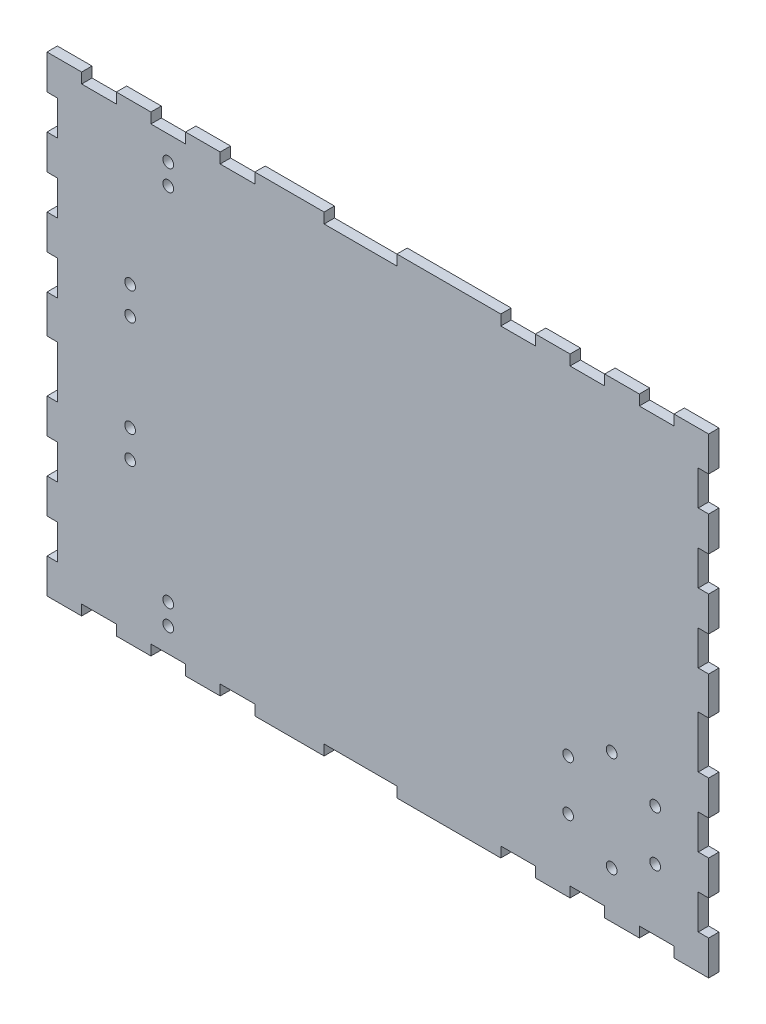
from build123d import *

# Parameters (mm, degrees)
SKETCH2_W           = 191
SKETCH2_H           = 136
SKETCH2_R           = 1.55
SKETCH2_R_2         = 1.549999948
BOSS_EXTRUDE1_DEPTH = 3
CUT_EXTRUDE1_REACH  = 236.491
SKETCH3_W           = 10
SKETCH3_H           = 3
SKETCH3_W_2         = 21
CUT_EXTRUDE2_REACH  = 236.491
SKETCH4_W           = 3
SKETCH4_H           = 10
SKETCH4_H_2         = 15


with BuildPart() as part:
    # Sketch2 → Boss-Extrude1 (new body)
    with BuildSketch(Plane.XY):
        with Locations((95.5, 68)):
            Rectangle(SKETCH2_W, SKETCH2_H)
        with Locations((35, 16)):
            Circle(SKETCH2_R, mode=Mode.SUBTRACT)
        with Locations((35, 10)):
            Circle(SKETCH2_R, mode=Mode.SUBTRACT)
        with Locations((24, 46.069195574)):
            Circle(SKETCH2_R, mode=Mode.SUBTRACT)
        with Locations((24, 54.069195574)):
            Circle(SKETCH2_R, mode=Mode.SUBTRACT)
        with Locations((24, 81.930804426)):
            Circle(SKETCH2_R, mode=Mode.SUBTRACT)
        with Locations((24, 89.930804426)):
            Circle(SKETCH2_R, mode=Mode.SUBTRACT)
        with Locations((35, 120)):
            Circle(SKETCH2_R, mode=Mode.SUBTRACT)
        with Locations((35, 126)):
            Circle(SKETCH2_R, mode=Mode.SUBTRACT)
        with Locations((175.557368355, 35.25)):
            Circle(SKETCH2_R_2, mode=Mode.SUBTRACT)
        with Locations((163, 42.5)):
            Circle(SKETCH2_R_2, mode=Mode.SUBTRACT)
        with Locations((150.442631645, 35.25)):
            Circle(SKETCH2_R_2, mode=Mode.SUBTRACT)
        with Locations((150.442631645, 20.75)):
            Circle(SKETCH2_R_2, mode=Mode.SUBTRACT)
        with Locations((163, 13.5)):
            Circle(SKETCH2_R_2, mode=Mode.SUBTRACT)
        with Locations((175.557368355, 20.75)):
            Circle(SKETCH2_R_2, mode=Mode.SUBTRACT)
    extrude(amount=BOSS_EXTRUDE1_DEPTH)

    # Sketch3 → Cut-Extrude1 (cut, up to next)
    with BuildSketch(Plane.XY.offset(3), mode=Mode.PRIVATE) as cut_extrude1_sk1:
        with Locations((176, 1.5)):
            Rectangle(SKETCH3_W, SKETCH3_H)
    cut_extrude1_tool1 = extrude(cut_extrude1_sk1.sketch, amount=-CUT_EXTRUDE1_REACH, mode=Mode.PRIVATE) & part.part
    # Sketch3 → Cut-Extrude1 (cut, up to next)
    with BuildSketch(Plane.XY.offset(3), mode=Mode.PRIVATE) as cut_extrude1_sk2:
        with Locations((156, 1.5)):
            Rectangle(SKETCH3_W, SKETCH3_H)
    cut_extrude1_tool2 = extrude(cut_extrude1_sk2.sketch, amount=-CUT_EXTRUDE1_REACH, mode=Mode.PRIVATE) & part.part
    # Sketch3 → Cut-Extrude1 (cut, up to next)
    with BuildSketch(Plane.XY.offset(3), mode=Mode.PRIVATE) as cut_extrude1_sk3:
        with Locations((136, 1.5)):
            Rectangle(SKETCH3_W, SKETCH3_H)
    cut_extrude1_tool3 = extrude(cut_extrude1_sk3.sketch, amount=-CUT_EXTRUDE1_REACH, mode=Mode.PRIVATE) & part.part
    # Sketch3 → Cut-Extrude1 (cut, up to next)
    with BuildSketch(Plane.XY.offset(3), mode=Mode.PRIVATE) as cut_extrude1_sk4:
        with Locations((90.5, 1.5)):
            Rectangle(SKETCH3_W_2, SKETCH3_H)
    cut_extrude1_tool4 = extrude(cut_extrude1_sk4.sketch, amount=-CUT_EXTRUDE1_REACH, mode=Mode.PRIVATE) & part.part
    # Sketch3 → Cut-Extrude1 (cut, up to next)
    with BuildSketch(Plane.XY.offset(3), mode=Mode.PRIVATE) as cut_extrude1_sk5:
        with Locations((55, 1.5)):
            Rectangle(SKETCH3_W, SKETCH3_H)
    cut_extrude1_tool5 = extrude(cut_extrude1_sk5.sketch, amount=-CUT_EXTRUDE1_REACH, mode=Mode.PRIVATE) & part.part
    # Sketch3 → Cut-Extrude1 (cut, up to next)
    with BuildSketch(Plane.XY.offset(3), mode=Mode.PRIVATE) as cut_extrude1_sk6:
        with Locations((35, 1.5)):
            Rectangle(SKETCH3_W, SKETCH3_H)
    cut_extrude1_tool6 = extrude(cut_extrude1_sk6.sketch, amount=-CUT_EXTRUDE1_REACH, mode=Mode.PRIVATE) & part.part
    # Sketch3 → Cut-Extrude1 (cut, up to next)
    with BuildSketch(Plane.XY.offset(3), mode=Mode.PRIVATE) as cut_extrude1_sk7:
        with Locations((15, 1.5)):
            Rectangle(SKETCH3_W, SKETCH3_H)
    cut_extrude1_tool7 = extrude(cut_extrude1_sk7.sketch, amount=-CUT_EXTRUDE1_REACH, mode=Mode.PRIVATE) & part.part
    cut_extrude1_1 = cut_extrude1_tool1.solids().sort_by_distance((176, 1.5, 3))[0]
    add(cut_extrude1_1, mode=Mode.SUBTRACT)
    cut_extrude1_2 = cut_extrude1_tool2.solids().sort_by_distance((156, 1.5, 3))[0]
    add(cut_extrude1_2, mode=Mode.SUBTRACT)
    cut_extrude1_3 = cut_extrude1_tool3.solids().sort_by_distance((136, 1.5, 3))[0]
    add(cut_extrude1_3, mode=Mode.SUBTRACT)
    cut_extrude1_4 = cut_extrude1_tool4.solids().sort_by_distance((90.5, 1.5, 3))[0]
    add(cut_extrude1_4, mode=Mode.SUBTRACT)
    cut_extrude1_5 = cut_extrude1_tool5.solids().sort_by_distance((55, 1.5, 3))[0]
    add(cut_extrude1_5, mode=Mode.SUBTRACT)
    cut_extrude1_6 = cut_extrude1_tool6.solids().sort_by_distance((35, 1.5, 3))[0]
    add(cut_extrude1_6, mode=Mode.SUBTRACT)
    cut_extrude1_7 = cut_extrude1_tool7.solids().sort_by_distance((15, 1.5, 3))[0]
    add(cut_extrude1_7, mode=Mode.SUBTRACT)
    cut_extrude1 = cut_extrude1_1 + cut_extrude1_2 + cut_extrude1_3 + cut_extrude1_4 + cut_extrude1_5 + cut_extrude1_6 + cut_extrude1_7  # Cut-Extrude1 as one shape, for the pattern or mirror that repeats it

    # Mirror1: Cut-Extrude1 across plane
    add(cut_extrude1.mirror(Plane.ZX.offset(68)), mode=Mode.SUBTRACT)

    # Sketch4 → Cut-Extrude2 (cut, up to next)
    with BuildSketch(Plane.XY.offset(3), mode=Mode.PRIVATE) as cut_extrude2_sk1:
        with Locations((1.5, 121)):
            Rectangle(SKETCH4_W, SKETCH4_H)
    cut_extrude2_tool1 = extrude(cut_extrude2_sk1.sketch, amount=-CUT_EXTRUDE2_REACH, mode=Mode.PRIVATE) & part.part
    # Sketch4 → Cut-Extrude2 (cut, up to next)
    with BuildSketch(Plane.XY.offset(3), mode=Mode.PRIVATE) as cut_extrude2_sk2:
        with Locations((1.5, 101)):
            Rectangle(SKETCH4_W, SKETCH4_H)
    cut_extrude2_tool2 = extrude(cut_extrude2_sk2.sketch, amount=-CUT_EXTRUDE2_REACH, mode=Mode.PRIVATE) & part.part
    # Sketch4 → Cut-Extrude2 (cut, up to next)
    with BuildSketch(Plane.XY.offset(3), mode=Mode.PRIVATE) as cut_extrude2_sk3:
        with Locations((1.5, 81)):
            Rectangle(SKETCH4_W, SKETCH4_H)
    cut_extrude2_tool3 = extrude(cut_extrude2_sk3.sketch, amount=-CUT_EXTRUDE2_REACH, mode=Mode.PRIVATE) & part.part
    # Sketch4 → Cut-Extrude2 (cut, up to next)
    with BuildSketch(Plane.XY.offset(3), mode=Mode.PRIVATE) as cut_extrude2_sk4:
        with Locations((1.5, 15)):
            Rectangle(SKETCH4_W, SKETCH4_H)
    cut_extrude2_tool4 = extrude(cut_extrude2_sk4.sketch, amount=-CUT_EXTRUDE2_REACH, mode=Mode.PRIVATE) & part.part
    # Sketch4 → Cut-Extrude2 (cut, up to next)
    with BuildSketch(Plane.XY.offset(3), mode=Mode.PRIVATE) as cut_extrude2_sk5:
        with Locations((1.5, 35)):
            Rectangle(SKETCH4_W, SKETCH4_H)
    cut_extrude2_tool5 = extrude(cut_extrude2_sk5.sketch, amount=-CUT_EXTRUDE2_REACH, mode=Mode.PRIVATE) & part.part
    # Sketch4 → Cut-Extrude2 (cut, up to next)
    with BuildSketch(Plane.XY.offset(3), mode=Mode.PRIVATE) as cut_extrude2_sk6:
        with Locations((1.5, 57.5)):
            Rectangle(SKETCH4_W, SKETCH4_H_2)
    cut_extrude2_tool6 = extrude(cut_extrude2_sk6.sketch, amount=-CUT_EXTRUDE2_REACH, mode=Mode.PRIVATE) & part.part
    cut_extrude2_1 = cut_extrude2_tool1.solids().sort_by_distance((1.5, 121, 3))[0]
    add(cut_extrude2_1, mode=Mode.SUBTRACT)
    cut_extrude2_2 = cut_extrude2_tool2.solids().sort_by_distance((1.5, 101, 3))[0]
    add(cut_extrude2_2, mode=Mode.SUBTRACT)
    cut_extrude2_3 = cut_extrude2_tool3.solids().sort_by_distance((1.5, 81, 3))[0]
    add(cut_extrude2_3, mode=Mode.SUBTRACT)
    cut_extrude2_4 = cut_extrude2_tool4.solids().sort_by_distance((1.5, 15, 3))[0]
    add(cut_extrude2_4, mode=Mode.SUBTRACT)
    cut_extrude2_5 = cut_extrude2_tool5.solids().sort_by_distance((1.5, 35, 3))[0]
    add(cut_extrude2_5, mode=Mode.SUBTRACT)
    cut_extrude2_6 = cut_extrude2_tool6.solids().sort_by_distance((1.5, 57.5, 3))[0]
    add(cut_extrude2_6, mode=Mode.SUBTRACT)
    cut_extrude2 = cut_extrude2_1 + cut_extrude2_2 + cut_extrude2_3 + cut_extrude2_4 + cut_extrude2_5 + cut_extrude2_6  # Cut-Extrude2 as one shape, for the pattern or mirror that repeats it

    # Mirror2: Cut-Extrude2 across plane
    add(cut_extrude2.mirror(Plane(origin=(95.5, 0, 0), x_dir=(0, 0, 1), z_dir=(1, 0, 0))), mode=Mode.SUBTRACT)


solid = part.part
